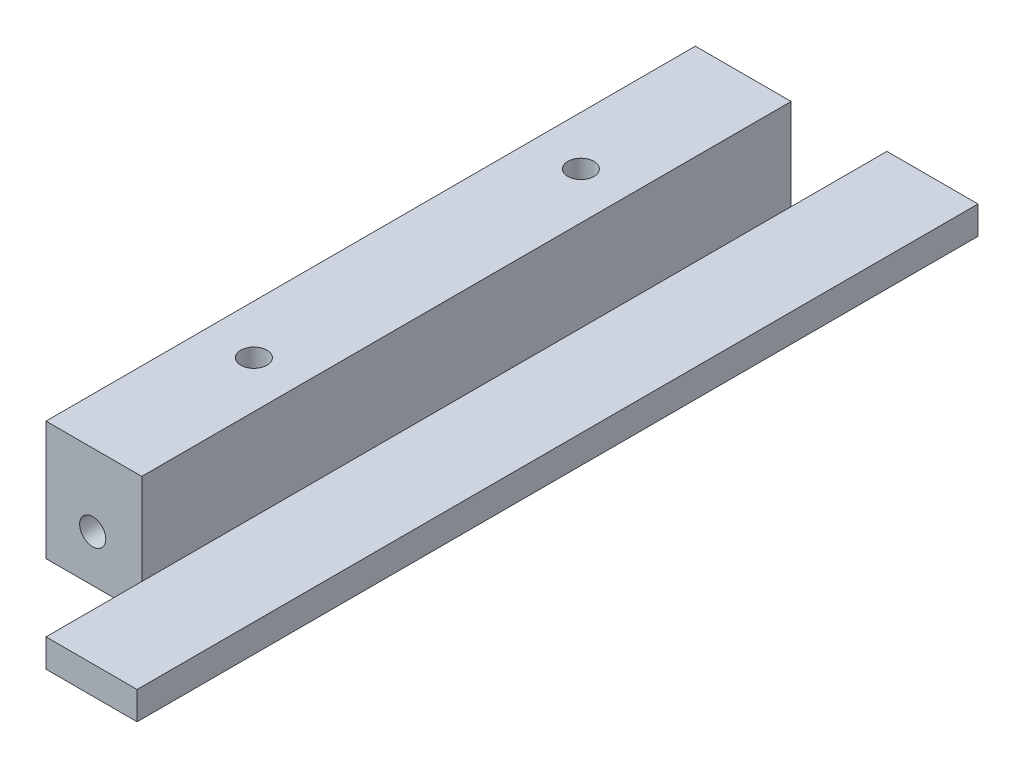
from build123d import *

# Parameters (mm, degrees)
DODANIE_WYCI_GNI_CIE1_DEPTH = 180
SZKIC2_W                    = 20.5
SZKIC2_H                    = 20.5
WYTNIJ_WYCI_GNI_CIE1_DEPTH  = 185.296805453
SZKIC3_R                    = 2.8
WYTNIJ_WYCI_GNI_CIE2_DEPTH  = 10
SZKIC4_R                    = 2.8
WYTNIJ_WYCI_GNI_CIE3_DEPTH  = 10


with BuildPart() as part:
    # Szkic1 → Dodanie-wyciągnięcie1 (new body)
    with BuildSketch(Plane.XY):
        Polygon((9.75, -15.75), (9.75, -9.75), (-9.75, -9.75), (-9.75, 9.75), (-30.25, 9.75), (-30.25, -15.75), align=None)
    extrude(amount=DODANIE_WYCI_GNI_CIE1_DEPTH)

    # Szkic2 → Wytnij-wyciągnięcie1 (cut, through all)
    with BuildSketch(Plane(origin=(0, 9.75, 0), x_dir=(1, 0, 0), z_dir=(0, 1, 0))):
        with Locations((-20, -169.75)):
            Rectangle(SZKIC2_W, SZKIC2_H)
    wytnij_wyci_gni_cie1 = extrude(amount=-WYTNIJ_WYCI_GNI_CIE1_DEPTH, mode=Mode.SUBTRACT)

    # Lustro1: Wytnij-wyciągnięcie1 across plane
    add(wytnij_wyci_gni_cie1.mirror(Plane.XY.offset(90)), mode=Mode.SUBTRACT)

    # Szkic3 → Wytnij-wyciągnięcie2 (cut)
    with BuildSketch(Plane(origin=(0, 9.75, 0), x_dir=(1, 0, 0), z_dir=(0, 1, 0))):
        with Locations((-19.75, -55.5)):
            Circle(SZKIC3_R)
        with Locations((-19.75, -125.5)):
            Circle(SZKIC3_R)
    extrude(amount=-WYTNIJ_WYCI_GNI_CIE2_DEPTH, mode=Mode.SUBTRACT)

    # Szkic4 → Wytnij-wyciągnięcie3 (cut)
    with BuildSketch(Plane.XY.offset(159.5)):
        with Locations((-20.25, -5.75)):
            Circle(SZKIC4_R)
    wytnij_wyci_gni_cie3 = extrude(amount=-WYTNIJ_WYCI_GNI_CIE3_DEPTH, mode=Mode.SUBTRACT)

    # Lustro2: Wytnij-wyciągnięcie3 across plane
    add(wytnij_wyci_gni_cie3.mirror(Plane.XY.offset(90)), mode=Mode.SUBTRACT)


solid = part.part
